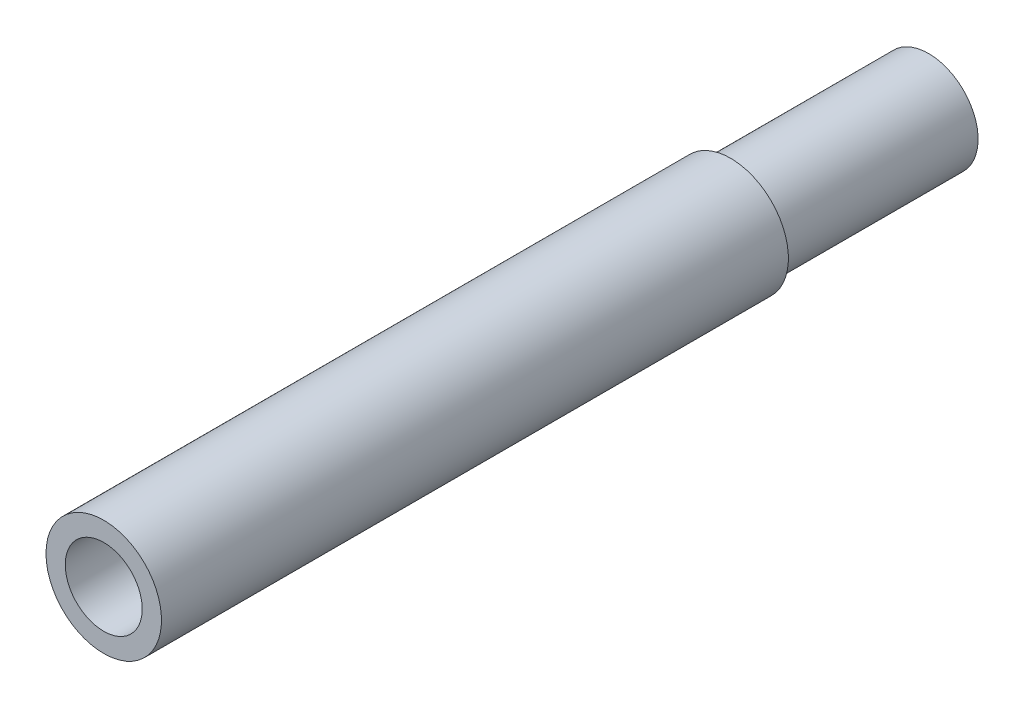
from build123d import *
from build123d.topology import SkipClean

# Parameters (mm, degrees)
SKETCH2_R           = 10.5
SKETCH2_R_2         = 7
BOSS_EXTRUDE1_DEPTH = 114
BOSS_EXTRUDE2_START = 36
SKETCH4_R           = 9
SKETCH4_R_2         = 7
BOSS_EXTRUDE2_DEPTH = 36


with BuildPart() as part:
    # Sketch2 → Boss-Extrude1 (new body)
    with BuildSketch(Plane.XY):
        Circle(SKETCH2_R)
        Circle(SKETCH2_R_2, mode=Mode.SUBTRACT)
    extrude(amount=BOSS_EXTRUDE1_DEPTH)

    # Sketch4 → Boss-Extrude2 (add)
    with SkipClean():  # the faces are left unmerged after this step: merging them gives an invalid solid
        with BuildSketch(Plane(origin=(0, 0, 0), x_dir=(-1, 0, 0), z_dir=(0, 0, -1)).offset(BOSS_EXTRUDE2_START)):
            Circle(SKETCH4_R)
            Circle(SKETCH4_R_2, mode=Mode.SUBTRACT)
        extrude(amount=-BOSS_EXTRUDE2_DEPTH)


solid = part.part
